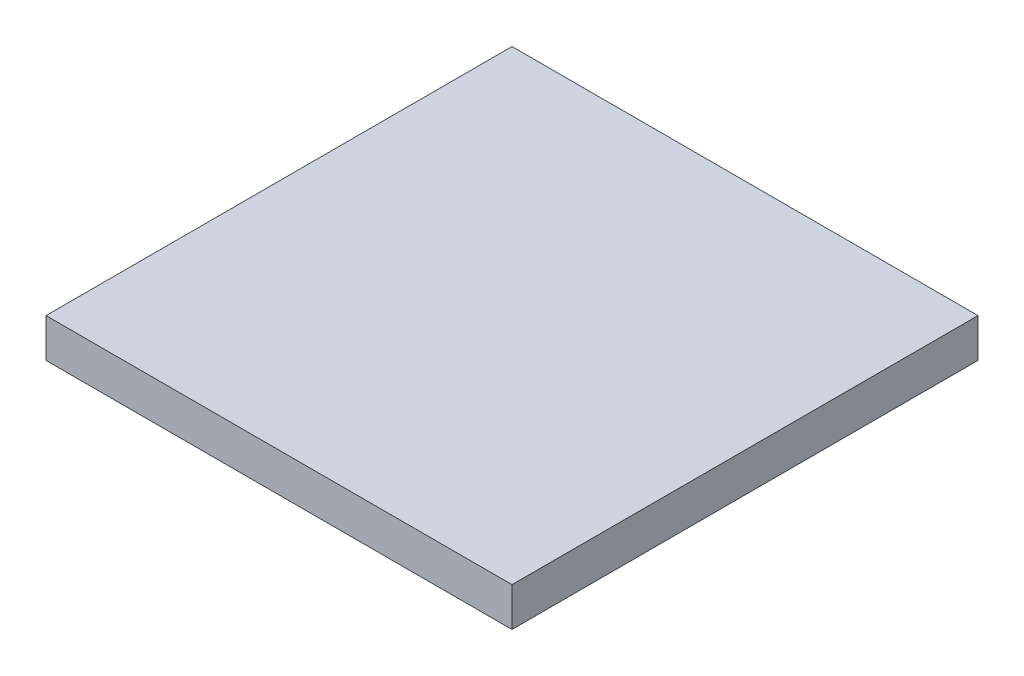
from build123d import *

# Parameters (mm, degrees)
SKETCH1_W           = 38.1
SKETCH1_H           = 38.1
BOSS_EXTRUDE1_DEPTH = 3.175


with BuildPart() as part:
    # Sketch1 → Boss-Extrude1 (new body)
    with BuildSketch(Plane(origin=(0, 0, 0), x_dir=(1, 0, 0), z_dir=(0, 1, 0))):
        with Locations((19.05, 19.05)):
            Rectangle(SKETCH1_W, SKETCH1_H)
    extrude(amount=BOSS_EXTRUDE1_DEPTH)


solid = part.part
